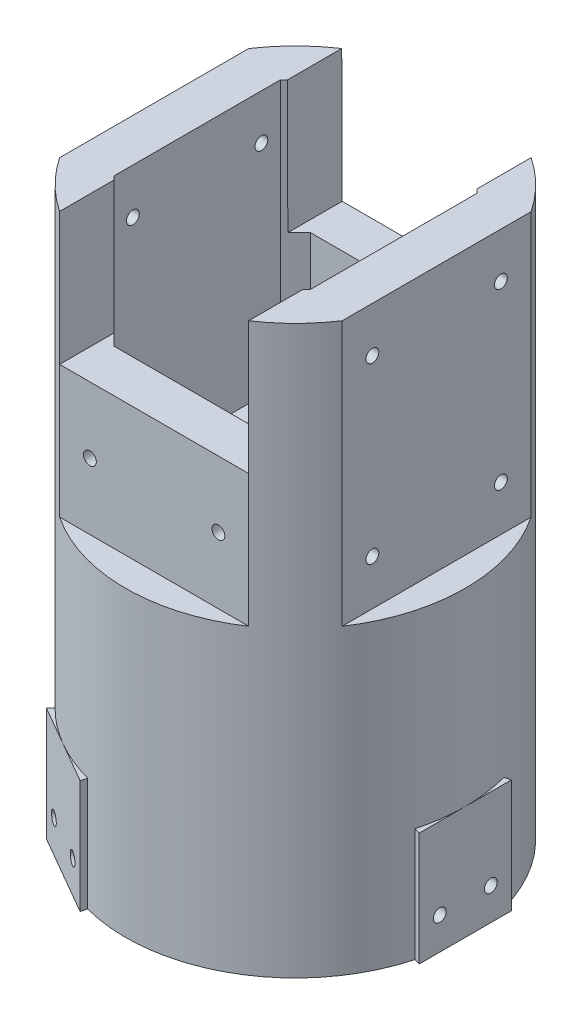
from build123d import *

# Parameters (mm, degrees)
BOSS_EXTRUDE1_DEPTH      = 30
SKETCH11_R               = 44.958564256
BOSS_EXTRUDE2_DEPTH      = 120
CUT_EXTRUDE1_DEPTH       = 163.940010531
SKETCH20_R               = 1.7
CUT_EXTRUDE13_DEPTH      = 24
SKETCH22_R               = 1.7
CUT_EXTRUDE14_DEPTH      = 24
SKETCH23_R               = 1.7
CUT_EXTRUDE15_DEPTH      = 24
CUT_EXTRUDE21_START      = -70
CUT_EXTRUDE21_DEPTH      = 70
CUT_EXTRUDE22_DEPTH      = 70
CIRPATTERN1_START        = 80
CIRPATTERN1_DEPTH        = 70
CHAMFER1_SIZE            = 4
SKETCH37_R               = 1.7
CUT_EXTRUDE23_DEPTH      = 177.933966729
CUT_EXTRUDE24_DEPTH      = 177.95016312
CUT_EXTRUDE24_DEPTH_BACK = 177.95016312
CUT_EXTRUDE25_DEPTH      = 177.95016312
CUT_EXTRUDE25_DEPTH_BACK = 177.95016312
SKETCH39_R               = 1.7


# Read off the part's stored shape, not the designer's step: CirPattern1
with BuildPart() as part:
    # Sketch2 → Boss-Extrude1 (new body)
    with BuildSketch(Plane(origin=(0, 0, 0), x_dir=(1, 0, 0), z_dir=(0, 1, 0))):
        with BuildLine():
            Line((-33.044792054, -32.835258764), (-11.913772202, -45.035258764))
            Line((-11.913772202, -45.035258764), (-11.497954912, -43.463427532))
            ThreePointArc((-11.497954912, -43.463427532), (0.991222154, -44.947635963), (13.402827335, -42.914295048))
            ThreePointArc((13.402827335, -42.914295048), (32.384657539, -31.185035772), (43.389409835, -11.77419272))
            Line((43.389409835, -11.77419272), (44.958564256, -12.2))
            Line((44.958564256, -12.2), (44.958564256, 12.2))
            Line((44.958564256, 12.2), (43.389409835, 11.77419272))
            ThreePointArc((43.389409835, 11.77419272), (38.393686215, 23.392249973), (30.359999068, 33.159356999))
            ThreePointArc((30.359999068, 33.159356999), (10.7465178, 43.655295843), (-11.497954912, 43.463427532))
            Line((-11.497954912, 43.463427532), (-11.913772202, 45.035258764))
            Line((-11.913772202, 45.035258764), (-33.044792054, 32.835258764))
            Line((-33.044792054, 32.835258764), (-31.891454922, 31.689234812))
            ThreePointArc((-31.891454922, 31.689234812), (-39.458623491, 21.547378777), (-43.899995544, 9.698602542))
            ThreePointArc((-43.899995544, 9.698602542), (-43.177821403, -12.527898422), (-31.891454922, -31.689234812))
            Line((-31.891454922, -31.689234812), (-33.044792054, -32.835258764))
        make_face()
    extrude(amount=BOSS_EXTRUDE1_DEPTH)

    # Sketch11 → Boss-Extrude2 (add)
    with BuildSketch(Plane(origin=(0, 30, 0), x_dir=(1, 0, 0), z_dir=(0, 1, 0))):
        with Locations(Location((0, 0, 0), (0, 0, 104.817769832))):
            Circle(SKETCH11_R)
    extrude(amount=BOSS_EXTRUDE2_DEPTH)

    # Sketch3 → Cut-Extrude1 (cut, through all)
    with BuildSketch(Plane(origin=(0, 0, 0), x_dir=(-1, 0, 0), z_dir=(0, -1, 0))):
        Polygon((21.650635095, 12.5), (0, 25), (-21.650635095, 12.5), (-21.650635095, -12.5), (0, -25), (21.650635095, -12.5), align=None)
    extrude(amount=-CUT_EXTRUDE1_DEPTH, mode=Mode.SUBTRACT)

    # Sketch20 → Cut-Extrude13 (cut)
    with BuildSketch(Plane(origin=(44.958564256, 0, 0), x_dir=(0, 0, -1), z_dir=(1, 0, 0))):
        with Locations((-6.75, 8.5)):
            Circle(SKETCH20_R)
        with Locations((6.75, 8.5)):
            Circle(SKETCH20_R)
    extrude(amount=-CUT_EXTRUDE13_DEPTH, mode=Mode.SUBTRACT)

    # Sketch22 → Cut-Extrude14 (cut)
    with BuildSketch(Plane(origin=(-22.479282128, 0, -38.935258764), x_dir=(-0.8660254037844386, 0, 0.5000000000000003), z_dir=(-0.5000000000000002, 0, -0.8660254037844385))):
        with Locations((6.75, 8.5)):
            Circle(SKETCH22_R)
        with Locations((-6.75, 8.5)):
            Circle(SKETCH22_R)
    extrude(amount=-CUT_EXTRUDE14_DEPTH, mode=Mode.SUBTRACT)

    # Sketch23 → Cut-Extrude15 (cut)
    with BuildSketch(Plane(origin=(-22.479282128, 0, 38.935258764), x_dir=(0.8660254037844386, 0, 0.5), z_dir=(-0.5000000000000001, 0, 0.8660254037844387))):
        with Locations((-6.75, 8.5)):
            Circle(SKETCH23_R)
        with Locations((6.75, 8.5)):
            Circle(SKETCH23_R)
    extrude(amount=-CUT_EXTRUDE15_DEPTH, mode=Mode.SUBTRACT)

    # Sketch35 → Cut-Extrude21 (cut)
    with BuildSketch(Plane(origin=(0, 150, 0), x_dir=(1, 0, 0), z_dir=(0, 1, 0)).offset(CUT_EXTRUDE21_START)):
        with BuildLine():
            Line((-37.366729854, 25), (-37.366729854, -25))
            ThreePointArc((-37.366729854, -25), (-44.958564256, 0), (-37.366729854, 25))
        make_face()
    extrude(amount=CUT_EXTRUDE21_DEPTH, mode=Mode.SUBTRACT)

    # Sketch36 → Cut-Extrude22 (cut)
    with BuildSketch(Plane(origin=(0, 150, 0), x_dir=(1, 0, 0), z_dir=(0, 1, 0))):
        Polygon((-26, 26), (-26, 0), (-26, -26), (0, -26), (26, -26), (26, 0), (26, 26), (0, 26), align=None)
    extrude(amount=-CUT_EXTRUDE22_DEPTH, mode=Mode.SUBTRACT)

    # CirPattern1 outline → CirPattern1 (cut)
    with BuildSketch(Plane(origin=(0, 0, 0), x_dir=(1, 0, 0), z_dir=(0, 1, 0)).offset(CIRPATTERN1_START)):
        with BuildLine():
            Line((25, -37.366729854), (-25, -37.366729854))
            ThreePointArc((-25, -37.366729854), (0, -44.958564256), (25, -37.366729854))
        make_face()
        with BuildLine():
            ThreePointArc((25, 37.366729854), (0, 44.958564256), (-25, 37.366729854))
            Line((-25, 37.366729854), (25, 37.366729854))
        make_face()
        with BuildLine():
            Line((37.366729854, 25), (37.366729854, -25))
            ThreePointArc((37.366729854, -25), (44.958564256, 0), (37.366729854, 25))
        make_face()
    extrude(amount=CIRPATTERN1_DEPTH, mode=Mode.SUBTRACT)

    # Chamfer1
    chamfer1_edges = [part.edges().sort_by_distance(p)[0] for p in [
        (-26, 115, -26),
        (26, 115, -26),
        (26, 115, 26),
        (-26, 115, 26),
    ]]
    chamfer(chamfer1_edges, length=CHAMFER1_SIZE)

    # Sketch37 → Cut-Extrude23 (cut, through all)
    with BuildSketch(Plane.ZY.offset(37.366729854)):
        with Locations(Location((-17, 138, 0), (0, 0, 180))):
            Circle(SKETCH37_R)
        with Locations(Location((-17, 92, 0), (0, 0, 180))):
            Circle(SKETCH37_R)
        with Locations(Location((17, 92, 0), (0, 0, 180))):
            Circle(SKETCH37_R)
        with Locations(Location((17, 138, 0), (0, 0, 180))):
            Circle(SKETCH37_R)
    extrude(amount=-CUT_EXTRUDE23_DEPTH, mode=Mode.SUBTRACT)

    # Sketch38 → Cut-Extrude24 (cut, two sides: drawn at the far end of the back side and taken through both)
    with BuildSketch(Plane(origin=(0, 0, -37.366729854), x_dir=(-1, 0, 0), z_dir=(0, 0, -1)).offset(-CUT_EXTRUDE24_DEPTH_BACK)):
        Polygon((-25, 150), (25.064026091, 150), (25, 115), (-25, 115), align=None)
    extrude(amount=CUT_EXTRUDE24_DEPTH + CUT_EXTRUDE24_DEPTH_BACK, mode=Mode.SUBTRACT)

    # Sketch39 → Cut-Extrude25 (cut, two sides: drawn at the far end of the back side and taken through both)
    with BuildSketch(Plane(origin=(0, 0, -37.366729854), x_dir=(-1, 0, 0), z_dir=(0, 0, -1)).offset(-CUT_EXTRUDE25_DEPTH_BACK)):
        with Locations((-17, 97.5)):
            Circle(SKETCH39_R)
        with Locations((17, 97.5)):
            Circle(SKETCH39_R)
    extrude(amount=CUT_EXTRUDE25_DEPTH + CUT_EXTRUDE25_DEPTH_BACK, mode=Mode.SUBTRACT)


solid = part.part
